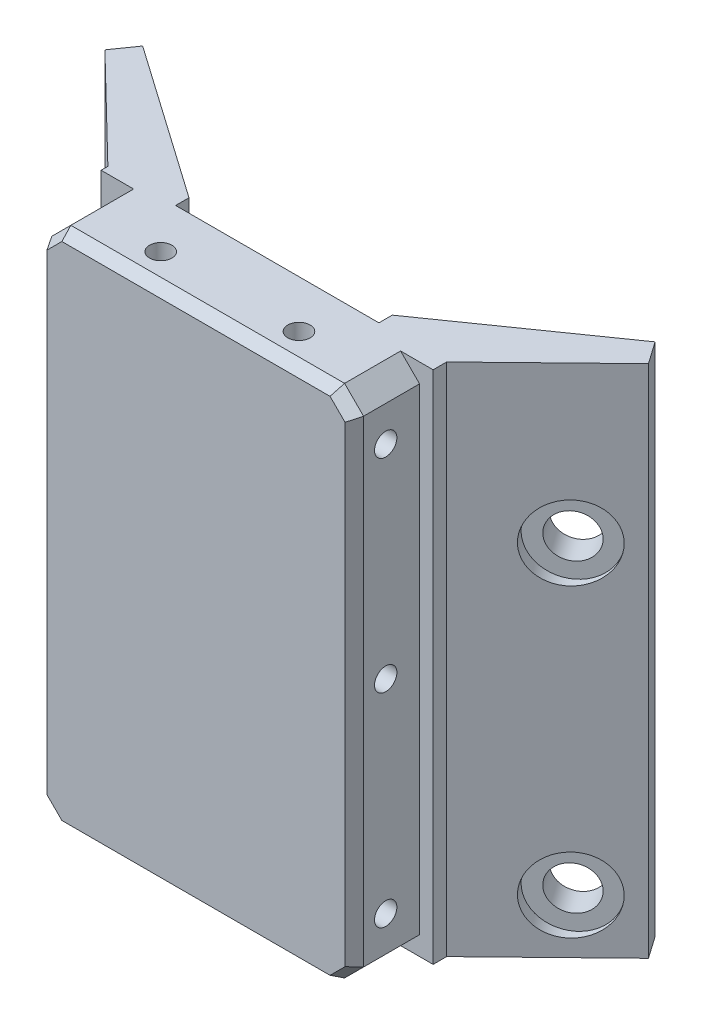
from build123d import *

# Parameters (mm, degrees)
BOSS_EXTRUDE1_DEPTH             = 38
BOSS_EXTRUDE1_DEPTH_BACK        = 38
SKETCH2_W                       = 46
SKETCH2_H                       = 76
BOSS_EXTRUDE2_DEPTH             = 10
ADVANCEDHOLE1_START             = 9.350877343
ADVANCEDHOLE1_OUTLINE_R         = 5.5
ADVANCEDHOLE1_DEPTH             = 2.175616923
ADVANCEDHOLE1_START_2           = 5.350877343
ADVANCEDHOLE1_2_OUTLINE_R       = 3.2
ADVANCEDHOLE1_2_DEPTH           = 4
ADVANCEDHOLE2_START             = -11.526494266
ADVANCEDHOLE2_OUTLINE_R         = 5.5
ADVANCEDHOLE2_DEPTH             = 2.175616923
ADVANCEDHOLE2_START_2           = -9.350877343
ADVANCEDHOLE2_2_OUTLINE_R       = 3.2
ADVANCEDHOLE2_2_DEPTH           = 4
SKETCH11_W                      = 2
SKETCH11_H                      = 76
CUT_EXTRUDE1_DEPTH              = 1
M4_TAPPED_HOLE1_D               = 3.3
M4_TAPPED_HOLE1_DEPTH           = 10.1
M4_TAPPED_HOLE1_TIP             = 0.991420021
M4_TAPPED_HOLE1_ON_FACE_2_D     = 3.3
M4_TAPPED_HOLE1_ON_FACE_2_DEPTH = 10.1
M4_TAPPED_HOLE1_ON_FACE_2_TIP   = 0.991420021
M4_TAPPED_HOLE1_ON_FACE_3_D     = 3.3
M4_TAPPED_HOLE1_ON_FACE_3_DEPTH = 10.1
M4_TAPPED_HOLE1_ON_FACE_3_TIP   = 0.991420021
M4_TAPPED_HOLE1_ON_FACE_4_D     = 3.3
M4_TAPPED_HOLE1_ON_FACE_4_DEPTH = 10.1
M4_TAPPED_HOLE1_ON_FACE_4_TIP   = 0.991420021
CHAMFER1_SIZE                   = 2.8
CHAMFER2_SIZE                   = 1
CHAMFER2_SIZE2                  = 1.732050808


# Read off the part's stored shape, not the designer's step: AdvancedHole1, AdvancedHole2
with BuildPart() as part:
    # Sketch1 → Boss-Extrude1 (new, two sides: drawn at the far end of the back side and taken through both)
    with BuildSketch(Plane(origin=(0, 0, 0), x_dir=(1, 0, 0), z_dir=(0, 1, 0)).offset(-BOSS_EXTRUDE1_DEPTH_BACK)):
        Polygon((-25, 2), (-40.107437881, 16.6682169), (-37.813132135, 19.944825077), (-15, 3.970897986), (-15, 2), (15, 2), (15, 3.970897986), (37.813132135, 19.944825077), (40.107437881, 16.6682169), (25, 2), (25, 0), (-25, 0), align=None)
    extrude(amount=BOSS_EXTRUDE1_DEPTH + BOSS_EXTRUDE1_DEPTH_BACK)

    # Sketch2 → Boss-Extrude2 (add)
    with BuildSketch(Plane.XY):
        Rectangle(SKETCH2_W, SKETCH2_H)
    extrude(amount=BOSS_EXTRUDE2_DEPTH)

    # AdvancedHole1 outline → AdvancedHole1 (cut)
    with BuildSketch(Plane(origin=(0, 0, 0), x_dir=(0.819152044288991, 0, -0.5735764363510472), z_dir=(0.5735764363510472, 0, 0.8191520442889911)).offset(ADVANCEDHOLE1_START)):
        with Locations((34.414586181, -30)):
            Circle(ADVANCEDHOLE1_OUTLINE_R)
        with Locations((34.414586181, 15)):
            Circle(ADVANCEDHOLE1_OUTLINE_R)
    extrude(amount=ADVANCEDHOLE1_DEPTH, mode=Mode.SUBTRACT)

    # AdvancedHole1 2 outline → AdvancedHole1 2 (cut)
    with BuildSketch(Plane(origin=(0, 0, 0), x_dir=(0.819152044288991, 0, -0.5735764363510472), z_dir=(0.5735764363510472, 0, 0.8191520442889911)).offset(ADVANCEDHOLE1_START_2)):
        with Locations((34.414586181, -30)):
            Circle(ADVANCEDHOLE1_2_OUTLINE_R)
        with Locations((34.414586181, 15)):
            Circle(ADVANCEDHOLE1_2_OUTLINE_R)
    extrude(amount=ADVANCEDHOLE1_2_DEPTH, mode=Mode.SUBTRACT)

    # AdvancedHole2 outline → AdvancedHole2 (cut)
    with BuildSketch(Plane(origin=(0, 0, 0), x_dir=(0.819152044288991, 0, 0.5735764363510472), z_dir=(0.5735764363510472, 0, -0.8191520442889911)).offset(ADVANCEDHOLE2_START)):
        with Locations((-34.414586181, 30)):
            Circle(ADVANCEDHOLE2_OUTLINE_R)
        with Locations((-34.414586181, -15)):
            Circle(ADVANCEDHOLE2_OUTLINE_R)
    extrude(amount=ADVANCEDHOLE2_DEPTH, mode=Mode.SUBTRACT)

    # AdvancedHole2 2 outline → AdvancedHole2 2 (cut)
    with BuildSketch(Plane(origin=(0, 0, 0), x_dir=(0.819152044288991, 0, 0.5735764363510472), z_dir=(0.5735764363510472, 0, -0.8191520442889911)).offset(ADVANCEDHOLE2_START_2)):
        with Locations((-34.414586181, 30)):
            Circle(ADVANCEDHOLE2_2_OUTLINE_R)
        with Locations((-34.414586181, -15)):
            Circle(ADVANCEDHOLE2_2_OUTLINE_R)
    extrude(amount=ADVANCEDHOLE2_2_DEPTH, mode=Mode.SUBTRACT)

    # Sketch11 → Cut-Extrude1 (cut)
    with BuildSketch(Plane.XY):
        with Locations((-24, 0)):
            Rectangle(SKETCH11_W, SKETCH11_H)
    extrude(amount=-CUT_EXTRUDE1_DEPTH, mode=Mode.SUBTRACT)

    # M4 Tapped Hole1
    with Locations(Plane(origin=(23, 30, 5), x_dir=(0, 1, 0), z_dir=(1, 0, 0))):
        with Locations((0, 0), (-60, 0), (-30, 0)):
            Hole(M4_TAPPED_HOLE1_D / 2, depth=M4_TAPPED_HOLE1_DEPTH)
            with Locations((0, 0, -(M4_TAPPED_HOLE1_DEPTH + M4_TAPPED_HOLE1_TIP / 2))):  # 118° drill point
                Cone(0, M4_TAPPED_HOLE1_D / 2, M4_TAPPED_HOLE1_TIP, mode=Mode.SUBTRACT)

    # M4 Tapped Hole1 on face 2
    with Locations(Plane(origin=(-23, 30, 5), x_dir=(0, 0, -1), z_dir=(-1, 0, 0))):
        with Locations((0, 0), (0, 60), (0, 30)):
            Hole(M4_TAPPED_HOLE1_ON_FACE_2_D / 2, depth=M4_TAPPED_HOLE1_ON_FACE_2_DEPTH)
            with Locations((0, 0, -(M4_TAPPED_HOLE1_ON_FACE_2_DEPTH + M4_TAPPED_HOLE1_ON_FACE_2_TIP / 2))):  # 118° drill point
                Cone(0, M4_TAPPED_HOLE1_ON_FACE_2_D / 2, M4_TAPPED_HOLE1_ON_FACE_2_TIP, mode=Mode.SUBTRACT)

    # M4 Tapped Hole1 on face 3
    with Locations(Plane(origin=(10.2, 38, 5), x_dir=(0, 0, 1), z_dir=(0, 1, 0))):
        with Locations((0, 0), (0, -20.4)):
            Hole(M4_TAPPED_HOLE1_ON_FACE_3_D / 2, depth=M4_TAPPED_HOLE1_ON_FACE_3_DEPTH)
            with Locations((0, 0, -(M4_TAPPED_HOLE1_ON_FACE_3_DEPTH + M4_TAPPED_HOLE1_ON_FACE_3_TIP / 2))):  # 118° drill point
                Cone(0, M4_TAPPED_HOLE1_ON_FACE_3_D / 2, M4_TAPPED_HOLE1_ON_FACE_3_TIP, mode=Mode.SUBTRACT)

    # M4 Tapped Hole1 on face 4
    with Locations(Plane(origin=(-10.2, -38, 5), x_dir=(0, 0, -1), z_dir=(0, -1, 0))):
        with Locations((0, 0), (0, 20.4)):
            Hole(M4_TAPPED_HOLE1_ON_FACE_4_D / 2, depth=M4_TAPPED_HOLE1_ON_FACE_4_DEPTH)
            with Locations((0, 0, -(M4_TAPPED_HOLE1_ON_FACE_4_DEPTH + M4_TAPPED_HOLE1_ON_FACE_4_TIP / 2))):  # 118° drill point
                Cone(0, M4_TAPPED_HOLE1_ON_FACE_4_D / 2, M4_TAPPED_HOLE1_ON_FACE_4_TIP, mode=Mode.SUBTRACT)

    # Chamfer1
    chamfer1_edges = [part.edges().sort_by_distance(p)[0] for p in [
        (23, -38, 5),
        (23, 38, 5),
        (-23, 38, 4.5),
        (-23, -38, 4.5),
    ]]
    chamfer(chamfer1_edges, length=CHAMFER1_SIZE)

    # Chamfer2
    chamfer2_edges = [part.edges().sort_by_distance(p)[0] for p in [
        (23, 0, 10),
        (0, -38, 10),
        (0, 38, 10),
        (-23, 0, 10),
        (21.6, 36.6, 10),
        (-21.6, 36.6, 10),
        (-21.6, -36.6, 10),
        (21.6, -36.6, 10),
    ]]
    chamfer2_side = [part.faces().sort_by_distance(p)[0] for p in [
        (0, 0, 10),
    ]]
    chamfer(chamfer2_edges, length=CHAMFER2_SIZE, length2=CHAMFER2_SIZE2, reference=chamfer2_side[0])


solid = part.part
